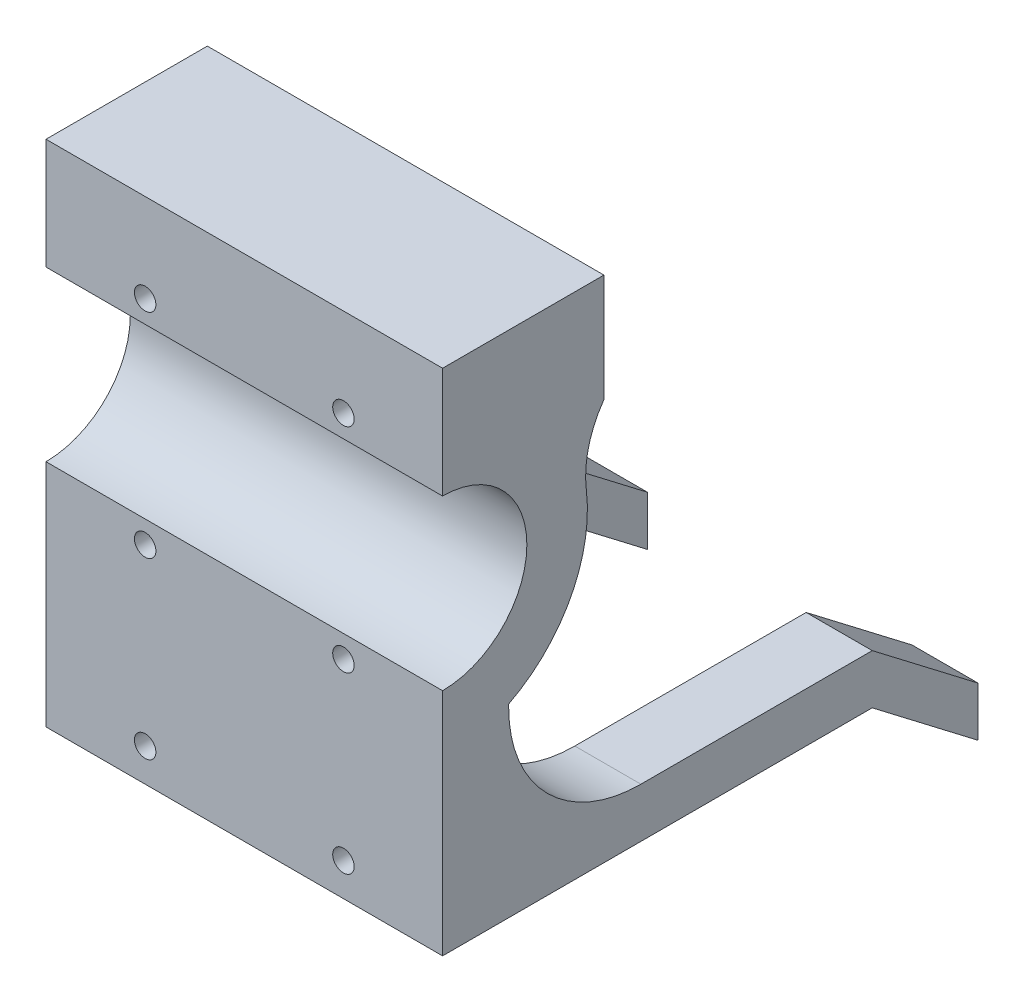
from build123d import *
from build123d.topology import SkipClean

# Parameters (mm, degrees)
SKETCH1_R                       = 60
BOSS_EXTRUDE1_DEPTH             = 10
SKETCH1_3_R                     = 1.625
CUT_EXTRUDE1_DEPTH              = 86.440037453
CIRPATTERN1_COUNT               = 3
CUT_EXTRUDE2_DEPTH              = 86.440037453
CIRPATTERN2_COUNT               = 3
SKETCH3_W                       = 60
SKETCH3_H                       = 10
BOSS_EXTRUDE2_DEPTH             = 77
BOSS_EXTRUDE3_REACH             = 108.685
BOSS_EXTRUDE3_DIRECTION_2_REACH = 108.685
FILLET1_R                       = 15
CUT_EXTRUDE3_DEPTH              = 107.685194831
CUT_EXTRUDE3_DEPTH_BACK         = 107.685194831
SKETCH4_4_R                     = 12.75
BOSS_EXTRUDE4_DEPTH             = 5
BOSS_EXTRUDE4_DEPTH_BACK        = 5
SKETCH7_R                       = 3
CUT_EXTRUDE4_DEPTH              = 135.046990627
SKETCH8_R                       = 3
SKETCH8_R_2                     = 1.625
BOSS_EXTRUDE5_DEPTH             = 10
LPATTERN2_COUNT                 = 2
LPATTERN2_PITCH                 = 32.26
LPATTERN3_COUNT                 = 2
LPATTERN3_PITCH                 = 58.63
FILLET2_R                       = 20
FILLET3_R                       = 20
FILLET4_R                       = 20
FILLET5_R                       = 20
SKETCH9_R                       = 103.204072212
CUT_EXTRUDE5_DEPTH              = 106.511484298
CUT_EXTRUDE7_DEPTH              = 99.814295079
SKETCH12_W                      = 60
SKETCH12_H                      = 24.41
BOSS_EXTRUDE6_DEPTH             = 10
CUT_EXTRUDE8_DEPTH              = 75.810748619
CUT_EXTRUDE8_DEPTH_BACK         = 2.5
SKETCH13_R                      = 1.625
SKETCH14_W                      = 55
SKETCH14_H                      = 7.5
BOSS_EXTRUDE7_DEPTH             = 10
BOSS_EXTRUDE8_DEPTH             = 10
FILLET6_R                       = 20
FILLET7_R                       = 20


with BuildPart() as part:
    # Sketch1 → Boss-Extrude1 (new body)
    with BuildSketch(Plane(origin=(0, 0, 0), x_dir=(1, 0, 0), z_dir=(0, 1, 0))):
        with Locations(Location((0, 0, 0), (0, 0, 270))):
            Circle(SKETCH1_R)
    extrude(amount=BOSS_EXTRUDE1_DEPTH)

    # Sketch1<3> → Cut-Extrude1 (cut, through all)
    with BuildSketch(Plane(origin=(0, 0, 0), x_dir=(1, 0, 0), z_dir=(0, 1, 0))):
        with Locations(Location((0, 50, 0), (0, 0, 270))):
            Circle(SKETCH1_3_R)
    cut_extrude1 = extrude(amount=CUT_EXTRUDE1_DEPTH, mode=Mode.SUBTRACT)

    # CirPattern1: Cut-Extrude1 ×3 about axis
    cirpattern1_axis = Axis((0, 0, 0), (0, 1, 0))
    for i in range(1, CIRPATTERN1_COUNT):
        add(cut_extrude1.rotate(cirpattern1_axis, i * 360 / CIRPATTERN1_COUNT), mode=Mode.SUBTRACT)

    # Sketch2 → Cut-Extrude2 (cut, through all)
    with BuildSketch(Plane(origin=(0, 10, 0), x_dir=(1, 0, 0), z_dir=(0, 1, 0))):
        with BuildLine():
            Line((43.871803017, -40.93), (0, -40.93))
            Line((0, -40.93), (-43.871803017, -40.93))
            ThreePointArc((-43.871803017, -40.93), (0, -60), (43.871803017, -40.93))
        make_face()
    cut_extrude2 = extrude(amount=-CUT_EXTRUDE2_DEPTH, mode=Mode.SUBTRACT)

    # CirPattern2: Cut-Extrude2 ×3 about axis
    cirpattern2_axis = Axis((0, 10.5, 0), (0, -1, 0))
    for i in range(1, CIRPATTERN2_COUNT):
        add(cut_extrude2.rotate(cirpattern2_axis, i * 360 / CIRPATTERN2_COUNT), mode=Mode.SUBTRACT)

    # Sketch3 → Boss-Extrude2 (add)
    with BuildSketch(Plane(origin=(0, 10, 0), x_dir=(1, 0, 0), z_dir=(0, 1, 0))):
        with Locations((0, -35.93)):
            Rectangle(SKETCH3_W, SKETCH3_H)
    extrude(amount=-BOSS_EXTRUDE2_DEPTH)

    # Boss-Extrude3: up to this face of the body (flat: up to its plane)
    boss_extrude3_end = Plane(part.part.faces().sort_by_distance((30, -33.5, 35.93))[0])
    # Sketch4 → Boss-Extrude3 (add, up to the picked face)
    with BuildSketch(Plane(origin=(0, 0, 0), x_dir=(0, 0, -1), z_dir=(1, 0, 0)), mode=Mode.PRIVATE) as boss_extrude3_sk1:
        with BuildLine():
            ThreePointArc((-19.02, -19.5), (-22.236059714, -8.072633873), (-30.940100101, 0))
            Line((-30.940100101, 0), (-40.93, 0))
            Line((-40.93, 0), (-40.93, -6.75))
            ThreePointArc((-40.93, -6.75), (-31.91438854, -10.48438854), (-28.18, -19.5))
            ThreePointArc((-28.18, -19.5), (-31.91438854, -28.51561146), (-40.93, -32.25))
            Line((-40.93, -32.25), (-40.93, -41.41))
            ThreePointArc((-40.93, -41.41), (-25.437290424, -34.992709576), (-19.02, -19.5))
        make_face()
    boss_extrude3_tool1 = split(extrude(boss_extrude3_sk1.sketch, amount=BOSS_EXTRUDE3_REACH, mode=Mode.PRIVATE), bisect_by=boss_extrude3_end, keep=Keep.BOTH, mode=Mode.PRIVATE)
    add(boss_extrude3_tool1.solids().sort_by(Axis((0, -10.153116, 31.583116), (1, 0, 0)))[0])

    # Boss-Extrude3 direction 2: up to this face of the body (flat: up to its plane)
    boss_extrude3_direction_2_end = Plane(part.part.faces().sort_by_distance((-30, -33.5, 35.93))[0])
    # Sketch4 → Boss-Extrude3 direction 2 (add, up to the picked face)
    with BuildSketch(Plane(origin=(0, 0, 0), x_dir=(0, 0, -1), z_dir=(1, 0, 0)), mode=Mode.PRIVATE) as boss_extrude3_direction_2_sk1:
        with BuildLine():
            ThreePointArc((-19.02, -19.5), (-22.236059714, -8.072633873), (-30.940100101, 0))
            Line((-30.940100101, 0), (-40.93, 0))
            Line((-40.93, 0), (-40.93, -6.75))
            ThreePointArc((-40.93, -6.75), (-31.91438854, -10.48438854), (-28.18, -19.5))
            ThreePointArc((-28.18, -19.5), (-31.91438854, -28.51561146), (-40.93, -32.25))
            Line((-40.93, -32.25), (-40.93, -41.41))
            ThreePointArc((-40.93, -41.41), (-25.437290424, -34.992709576), (-19.02, -19.5))
        make_face()
    boss_extrude3_direction_2_tool1 = split(extrude(boss_extrude3_direction_2_sk1.sketch, amount=-BOSS_EXTRUDE3_DIRECTION_2_REACH, mode=Mode.PRIVATE), bisect_by=boss_extrude3_direction_2_end, keep=Keep.BOTH, mode=Mode.PRIVATE)
    add(boss_extrude3_direction_2_tool1.solids().sort_by(Axis((0, -10.153116, 31.583116), (-1, 0, 0)))[0])

    # Fillet1
    # the kernel refuses this fillet: 15 mm, written as the material it adds along each edge
    with BuildSketch(Plane(origin=(-30, 0, 30.93), x_dir=(0, -0.8200000187317443, -0.5723634940140219), z_dir=(1, 0, 0))) as fillet1_piece_1:
        with BuildLine():
            CenterArc((27.544705674, 13.254966901), FILLET1_R, 145.084795628, 97.002819116)
            Line((15.244705393, 21.840419312), (14.014705365, 22.698964553))
            Line((14.014705365, 22.698964553), (-1.230000028, 0.858545241))
            Line((-1.230000028, 0.858545241), (-0.858545241, -1.230000028))
            ThreePointArc((-0.858545241, -1.230000028), (0.706809752, -1.32825728), (19.820711794, -1.32549669))
            Line((19.820711794, -1.32549669), (20.522893056, 0))
        make_face()
    extrude(amount=60)
    with BuildSketch(Plane(origin=(30, -0.00517761, 30.93), x_dir=(0, 0.0001943937305955909, -0.9999999811055386), z_dir=(-1, 0, 0))) as fillet1_piece_2:
        with BuildLine():
            CenterArc((26.631741686, 14.999999717), FILLET1_R, 173.008318825, 97.002819116)
            Line((11.743284153, 16.825878219), (10.2544384, 17.008466069))
            ThreePointArc((10.2544384, 17.008466069), (6.732994571, 7.811775416), (-0.684878331, 1.334519266))
            Line((-0.684878331, 1.334519266), (-1.499999972, -0.000291591))
            ThreePointArc((-1.499999972, -0.000291591), (0.000292597, -1.505177582), (26.634949182, -1.499999972))
            Line((26.634949182, -1.499999972), (26.634657592, 0))
        make_face()
    extrude(amount=60)

    # Sketch4<4> → Cut-Extrude3 (cut, two sides: drawn at the far end of the back side and taken through both)
    with BuildSketch(Plane(origin=(0, 0, 0), x_dir=(0, 0, -1), z_dir=(1, 0, 0)).offset(-CUT_EXTRUDE3_DEPTH_BACK)):
        with Locations((-40.93, -19.5)):
            Circle(SKETCH4_4_R)
    extrude(amount=CUT_EXTRUDE3_DEPTH + CUT_EXTRUDE3_DEPTH_BACK, mode=Mode.SUBTRACT)

    # Sketch6 → Boss-Extrude4 (add, two sides: drawn at the far end of the back side and taken through both)
    with BuildSketch(Plane(origin=(0, 0, 0), x_dir=(0, 0, -1), z_dir=(1, 0, 0)).offset(-BOSS_EXTRUDE4_DEPTH_BACK)):
        Polygon((-30.93, -57), (-30.93, -67), (40.93, 0), (30.93, 0), align=None)
    extrude(amount=BOSS_EXTRUDE4_DEPTH + BOSS_EXTRUDE4_DEPTH_BACK)

    # Sketch7 → Cut-Extrude4 (cut, through all)
    with BuildSketch(Plane.XY.offset(40.93)):
        with Locations((-15, -3.375)):
            Circle(SKETCH7_R)
        with Locations((15, -3.375)):
            Circle(SKETCH7_R)
    cut_extrude4 = extrude(amount=-CUT_EXTRUDE4_DEPTH, mode=Mode.SUBTRACT)

    # Sketch8 → Boss-Extrude5 (add)
    # profile 1 of 2: a face of its own
    with BuildSketch(Plane.XY.offset(40.93)):
        with Locations((-15, -3.375)):
            Circle(SKETCH8_R)
        with Locations((-15, -3.375)):
            Circle(SKETCH8_R_2, mode=Mode.SUBTRACT)
    # profile 2 of 2: a face of its own
    with BuildSketch(Plane.XY.offset(40.93)):
        with Locations((15, -3.375)):
            Circle(SKETCH8_R)
        with Locations((15, -3.375)):
            Circle(SKETCH8_R_2, mode=Mode.SUBTRACT)
    boss_extrude5 = extrude(amount=-BOSS_EXTRUDE5_DEPTH)

    # LPattern2: Cut-Extrude4, Boss-Extrude5 ×2
    with Locations(*[(0, -i * LPATTERN2_PITCH, 0) for i in range(1, LPATTERN2_COUNT)]):
        add(cut_extrude4, mode=Mode.SUBTRACT)
        add(boss_extrude5)

    # LPattern3: Cut-Extrude4, Boss-Extrude5 ×2
    with Locations(*[(0, -i * LPATTERN3_PITCH, 0) for i in range(1, LPATTERN3_COUNT)]):
        add(cut_extrude4, mode=Mode.SUBTRACT)
        add(boss_extrude5)

    # Fillet2
    fillet2_edges = [part.edges().sort_by_distance(p)[0] for p in [
        (57.382321286, 5, 17.529095923),
    ]]
    fillet(fillet2_edges, radius=FILLET2_R)

    # Fillet3
    fillet3_edges = [part.edges().sort_by_distance(p)[0] for p in [
        (13.510518268, 5, -58.459095923),
    ]]
    fillet(fillet3_edges, radius=FILLET3_R)

    # Fillet4
    fillet4_edges = [part.edges().sort_by_distance(p)[0] for p in [
        (-13.510518268, 5, -58.459095923),
    ]]
    fillet(fillet4_edges, radius=FILLET4_R)

    # Fillet5
    fillet5_edges = [part.edges().sort_by_distance(p)[0] for p in [
        (-57.382321286, 5, 17.529095923),
    ]]
    fillet(fillet5_edges, radius=FILLET5_R)

    # Sketch9 → Cut-Extrude5 (cut, through all)
    with BuildSketch(Plane(origin=(0, 0, 0), x_dir=(1, 0, 0), z_dir=(0, 1, 0))):
        Circle(SKETCH9_R)
    extrude(amount=CUT_EXTRUDE5_DEPTH, mode=Mode.SUBTRACT)

    # Sketch11 → Cut-Extrude7 (cut, through all)
    with BuildSketch(Plane(origin=(30, 0, 0), x_dir=(0, 0, -1), z_dir=(1, 0, 0))):
        with BuildLine():
            Line((87.220165035, 0), (-4.295342911, 0))
            ThreePointArc((-4.295342911, 0), (-11.173353185, -1.669847162), (-16.52, -6.307603376))
            Line((-16.52, -6.307603376), (-16.52, -19.5))
            Line((-16.52, -19.5), (-19.02, -19.5))
            ThreePointArc((-19.02, -19.5), (-22.233100524, -30.922523802), (-30.93, -38.99482239))
            Line((-30.93, -38.99482239), (-30.93, -67))
            Line((-30.93, -67), (87.220165035, -67))
            Line((87.220165035, -67), (87.220165035, 0))
        make_face()
        with BuildLine():
            Line((-4.295342911, 0), (-16.52, 0))
            Line((-16.52, 0), (-16.52, -6.307603376))
            ThreePointArc((-16.52, -6.307603376), (-11.173353185, -1.669847162), (-4.295342911, 0))
        make_face()
    extrude(amount=-CUT_EXTRUDE7_DEPTH, mode=Mode.SUBTRACT)

    # Sketch12 → Boss-Extrude6 (add)
    with BuildSketch(Plane(origin=(0, 0, 0), x_dir=(1, 0, 0), z_dir=(0, 1, 0))):
        with Locations((0, -28.725)):
            Rectangle(SKETCH12_W, SKETCH12_H)
    extrude(amount=BOSS_EXTRUDE6_DEPTH)

    # Sketch13 → Cut-Extrude8 (cut, two sides: drawn at the far end of the back side and taken through both)
    # profile 1 of 6: a face of its own
    with SkipClean():  # the faces are left unmerged after this step: merging them gives an invalid solid
        with BuildSketch(Plane(origin=(0, 0, 30.93), x_dir=(-1, 0, 0), z_dir=(0, 0, -1)).offset(-CUT_EXTRUDE8_DEPTH_BACK)):
            with BuildLine():
                ThreePointArc((17.956663991, -3.883072871), (18, -3.375), (17.956663991, -2.866927129))
                Line((17.956663991, -2.866927129), (16.918336009, -1.068490308))
                ThreePointArc((16.918336009, -1.068490308), (16.5, -0.776923789), (16.038327983, -0.560417438))
                Line((16.038327983, -0.560417438), (13.961672017, -0.560417438))
                ThreePointArc((13.961672017, -0.560417438), (13.5, -0.776923789), (13.081663991, -1.068490308))
                Line((13.081663991, -1.068490308), (12.043336009, -2.866927129))
                ThreePointArc((12.043336009, -2.866927129), (12, -3.375), (12.043336009, -3.883072871))
                Line((12.043336009, -3.883072871), (13.081663991, -5.681509692))
                ThreePointArc((13.081663991, -5.681509692), (13.5, -5.973076211), (13.961672017, -6.189582562))
                Line((13.961672017, -6.189582562), (16.038327983, -6.189582562))
                ThreePointArc((16.038327983, -6.189582562), (16.5, -5.973076211), (16.918336009, -5.681509692))
                Line((16.918336009, -5.681509692), (17.956663991, -3.883072871))
            make_face()
            with Locations(Location((15, -3.375, 0), (0, 0, 180))):
                Circle(SKETCH13_R, mode=Mode.SUBTRACT)
        # profile 2 of 6: a face of its own
        with BuildSketch(Plane(origin=(0, 0, 30.93), x_dir=(-1, 0, 0), z_dir=(0, 0, -1)).offset(-CUT_EXTRUDE8_DEPTH_BACK)):
            Polygon((-11.75, -3.375), (-13.375, -0.560417438), (-16.625, -0.560417438), (-18.25, -3.375), (-16.625, -6.189582562), (-13.375, -6.189582562), align=None)
            with Locations(Location((-15, -3.375, 0), (0, 0, 180))):
                Circle(SKETCH13_R, mode=Mode.SUBTRACT)
        # profile 3 of 6: a face of its own
        with BuildSketch(Plane(origin=(0, 0, 30.93), x_dir=(-1, 0, 0), z_dir=(0, 0, -1)).offset(-CUT_EXTRUDE8_DEPTH_BACK)):
            Polygon((-11.75, -35.635), (-13.375, -32.820417438), (-16.625, -32.820417438), (-18.25, -35.635), (-16.625, -38.449582562), (-13.375, -38.449582562), align=None)
            with Locations(Location((-15, -35.635, 0), (0, 0, 180))):
                Circle(SKETCH13_R, mode=Mode.SUBTRACT)
        # profile 4 of 6: a face of its own
        with BuildSketch(Plane(origin=(0, 0, 30.93), x_dir=(-1, 0, 0), z_dir=(0, 0, -1)).offset(-CUT_EXTRUDE8_DEPTH_BACK)):
            Polygon((18.25, -35.635), (16.625, -32.820417438), (13.375, -32.820417438), (11.75, -35.635), (13.375, -38.449582562), (16.625, -38.449582562), align=None)
            with Locations(Location((15, -35.635, 0), (0, 0, 180))):
                Circle(SKETCH13_R, mode=Mode.SUBTRACT)
        # profile 5 of 6: a face of its own
        with BuildSketch(Plane(origin=(0, 0, 30.93), x_dir=(-1, 0, 0), z_dir=(0, 0, -1)).offset(-CUT_EXTRUDE8_DEPTH_BACK)):
            Polygon((-13.375, -64.819582562), (-11.75, -62.005), (-13.375, -59.190417438), (-16.625, -59.190417438), (-18.25, -62.005), (-16.625, -64.819582562), align=None)
            with Locations(Location((-15, -62.005, 0), (0, 0, 180))):
                Circle(SKETCH13_R, mode=Mode.SUBTRACT)
        # profile 6 of 6: a face of its own
        with BuildSketch(Plane(origin=(0, 0, 30.93), x_dir=(-1, 0, 0), z_dir=(0, 0, -1)).offset(-CUT_EXTRUDE8_DEPTH_BACK)):
            Polygon((16.625, -64.819582562), (18.25, -62.005), (16.625, -59.190417438), (13.375, -59.190417438), (11.75, -62.005), (13.375, -64.819582562), align=None)
            with Locations(Location((15, -62.005, 0), (0, 0, 180))):
                Circle(SKETCH13_R, mode=Mode.SUBTRACT)
        extrude(amount=CUT_EXTRUDE8_DEPTH + CUT_EXTRUDE8_DEPTH_BACK, mode=Mode.SUBTRACT)
    add(part.part.scale(1), mode=Mode.REPLACE)  # the faces are merged on a copy

    # Sketch14 → Boss-Extrude7 (add)
    with BuildSketch(Plane(origin=(30, 0, 0), x_dir=(0, 0, -1), z_dir=(1, 0, 0))):
        with Locations((-3.43, -63.25)):
            Rectangle(SKETCH14_W, SKETCH14_H)
    boss_extrude7 = extrude(amount=-BOSS_EXTRUDE7_DEPTH)

    # Sketch15 → Boss-Extrude8 (add)
    with BuildSketch(Plane(origin=(30, 0, 0), x_dir=(0, 0, -1), z_dir=(1, 0, 0))):
        Polygon((40.07, -79.25), (40.07, -71.75), (24.07, -59.5), (24.07, -67), align=None)
    boss_extrude8 = extrude(amount=-BOSS_EXTRUDE8_DEPTH)

    # Fillet6
    fillet6_edges = [part.edges().sort_by_distance(p)[0] for p in [
        (25, -59.5, 30.93),
    ]]
    fillet(fillet6_edges, radius=FILLET6_R)

    # Mirror1: Boss-Extrude7, Boss-Extrude8 across plane
    add(boss_extrude7.mirror(Plane(origin=(0, 0, 0), x_dir=(0, 0, 1), z_dir=(1, 0, 0))))
    add(boss_extrude8.mirror(Plane(origin=(0, 0, 0), x_dir=(0, 0, 1), z_dir=(1, 0, 0))))

    # Fillet7
    fillet7_edges = [part.edges().sort_by_distance(p)[0] for p in [
        (-25, -59.5, 30.93),
    ]]
    fillet(fillet7_edges, radius=FILLET7_R)


solid = part.part
